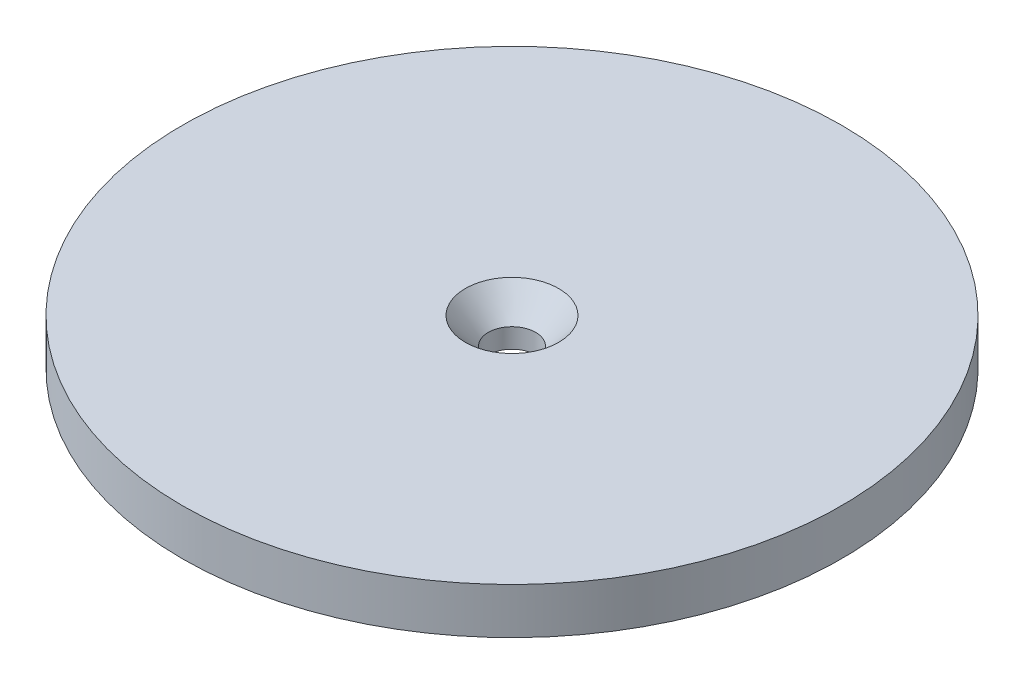
from build123d import *

# Parameters (mm, degrees)
SKETCH1_R                                        = 45.466
BOSS_EXTRUDE1_DEPTH                              = 25.4
CSK_FOR_1_4_FLAT_HEAD_MACHINE_SCREW1_D           = 6.5278
CSK_FOR_1_4_FLAT_HEAD_MACHINE_SCREW1_DEPTH       = 25.4
CSK_FOR_1_4_FLAT_HEAD_MACHINE_SCREW1_CSINK_D     = 12.8778
CSK_FOR_1_4_FLAT_HEAD_MACHINE_SCREW1_CSINK_ANGLE = 82
CSK_FOR_1_4_FLAT_HEAD_MACHINE_SCREW1_TIP         = 1.961148974
SKETCH9_R                                        = 53.031918303
CUT_EXTRUDE3_DEPTH                               = 12.7
SKETCH11_R                                       = 48.963999794
CUT_EXTRUDE4_DEPTH                               = 6.35


with BuildPart() as part:
    # Sketch1 → Boss-Extrude1 (new body)
    with BuildSketch(Plane(origin=(0, 0, 0), x_dir=(1, 0, 0), z_dir=(0, 1, 0))):
        Circle(SKETCH1_R)
    extrude(amount=BOSS_EXTRUDE1_DEPTH)

    # CSK for 1/4 Flat Head Machine Screw1
    with Locations(Plane(origin=(0, 25.4, 0), x_dir=(1, 0, 0), z_dir=(0, 1, 0))):
        with Locations((0, 0)):
            CounterSinkHole(CSK_FOR_1_4_FLAT_HEAD_MACHINE_SCREW1_D / 2, CSK_FOR_1_4_FLAT_HEAD_MACHINE_SCREW1_CSINK_D / 2, depth=CSK_FOR_1_4_FLAT_HEAD_MACHINE_SCREW1_DEPTH, counter_sink_angle=CSK_FOR_1_4_FLAT_HEAD_MACHINE_SCREW1_CSINK_ANGLE)
            with Locations((0, 0, -(CSK_FOR_1_4_FLAT_HEAD_MACHINE_SCREW1_DEPTH + CSK_FOR_1_4_FLAT_HEAD_MACHINE_SCREW1_TIP / 2))):  # 118° drill point
                Cone(0, CSK_FOR_1_4_FLAT_HEAD_MACHINE_SCREW1_D / 2, CSK_FOR_1_4_FLAT_HEAD_MACHINE_SCREW1_TIP, mode=Mode.SUBTRACT)

    # Sketch9 → Cut-Extrude3 (cut)
    with BuildSketch(Plane.XZ):
        Circle(SKETCH9_R)
    extrude(amount=-CUT_EXTRUDE3_DEPTH, mode=Mode.SUBTRACT)

    # Sketch11 → Cut-Extrude4 (cut)
    with BuildSketch(Plane.XZ.offset(-12.7)):
        Circle(SKETCH11_R)
    extrude(amount=-CUT_EXTRUDE4_DEPTH, mode=Mode.SUBTRACT)


solid = part.part
